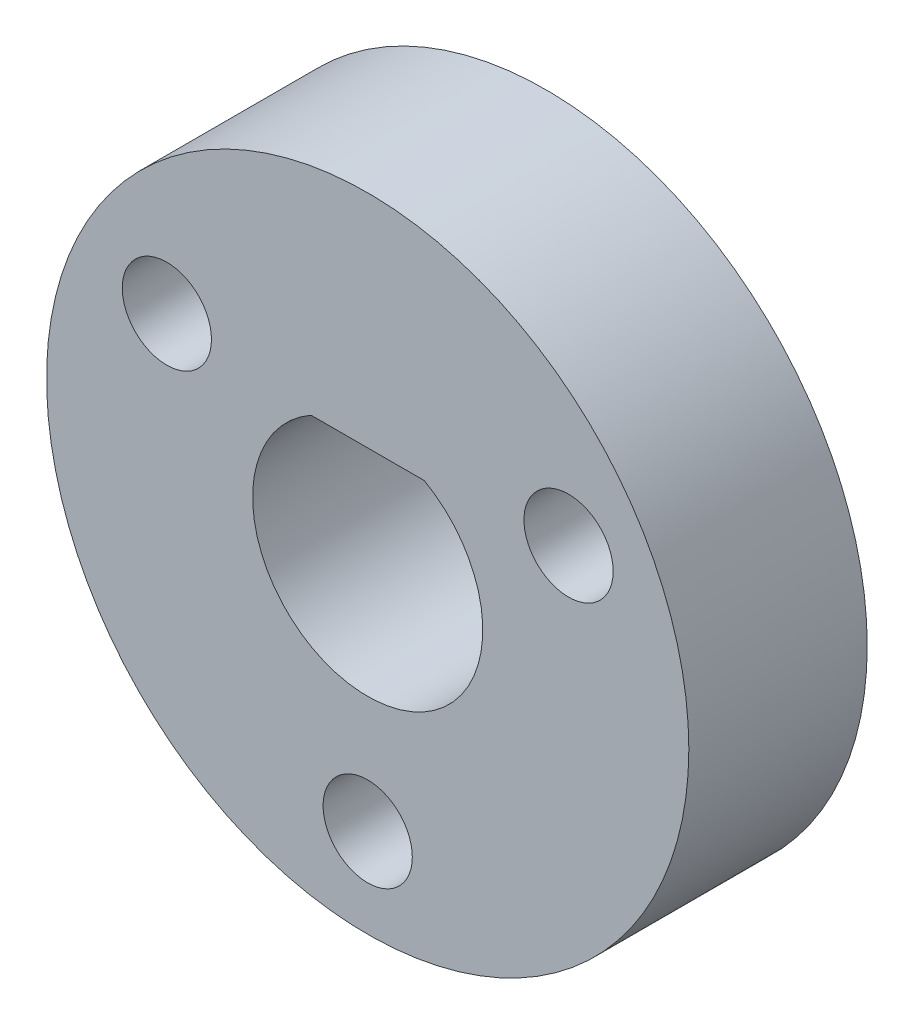
from build123d import *

# Parameters (mm, degrees)
SKETCH1_R              = 9
BOSS_EXTRUDE1_DEPTH    = 2.5
M2_5_CLEARANCE_HOLE2_D = 2.5
CIRPATTERN1_COUNT      = 3


with BuildPart() as part:
    # Sketch1 → Boss-Extrude1 (new, symmetric)
    with BuildSketch(Plane.XY):
        Circle(SKETCH1_R)
        with BuildLine():
            Line((-1.5875, 2.807217261), (1.5875, 2.807217261))
            ThreePointArc((1.5875, 2.807217261), (0, -3.225), (-1.5875, 2.807217261))
        make_face(mode=Mode.SUBTRACT)
    extrude(amount=BOSS_EXTRUDE1_DEPTH, both=True)

    # M2.5 Clearance Hole2 (through all)
    with Locations(Plane.XY.offset(2.5)):
        with Locations((0, -6.5)):
            m2_5_clearance_hole2 = Hole(M2_5_CLEARANCE_HOLE2_D / 2)

    # CirPattern1: M2.5 Clearance Hole2 ×3 about axis
    cirpattern1_axis = Axis((0, 0, 2.5), (0, 0, -1))
    for i in range(1, CIRPATTERN1_COUNT):
        add(m2_5_clearance_hole2.rotate(cirpattern1_axis, i * 360 / CIRPATTERN1_COUNT), mode=Mode.SUBTRACT)


solid = part.part
